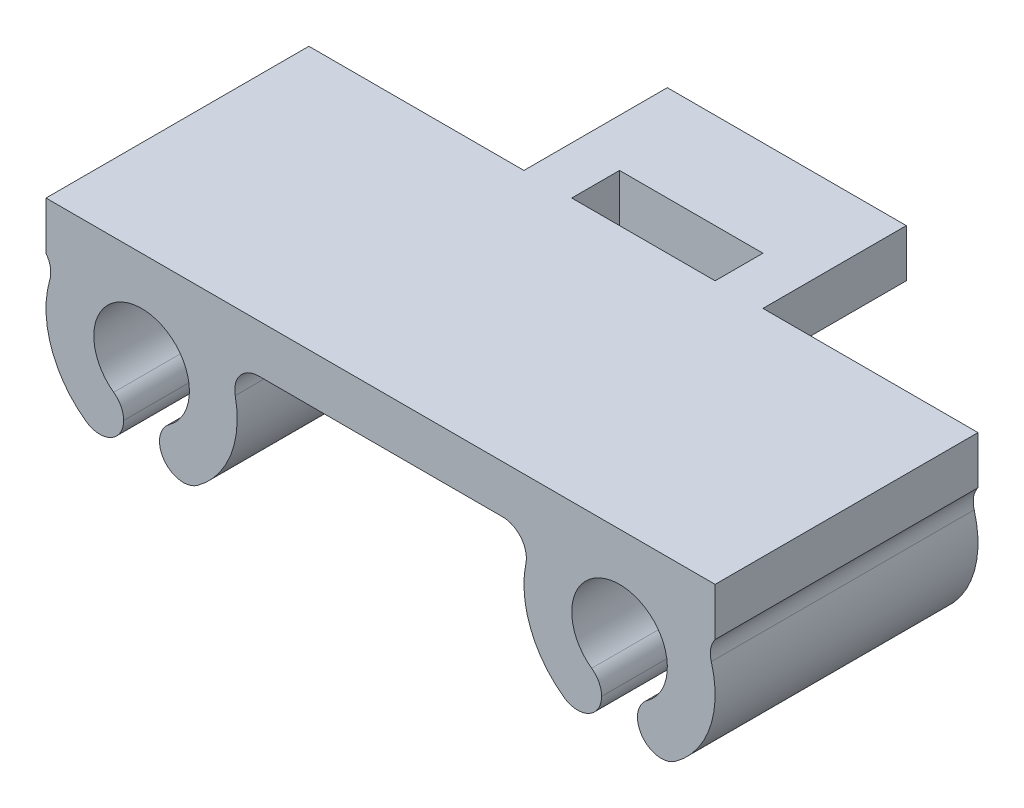
from build123d import *

# Parameters (mm, degrees)
SKETCH1_W           = 6
SKETCH1_H           = 2
BOSS_EXTRUDE1_DEPTH = 2
BOSS_EXTRUDE2_DEPTH = 5.5
FILLET1_R           = 1


with BuildPart() as part:
    # Sketch1 → Boss-Extrude1 (new body)
    with BuildSketch(Plane(origin=(0, 0, 0), x_dir=(1, 0, 0), z_dir=(0, 1, 0))):
        Polygon((-14, 5.5), (-14, -5.5), (14, -5.5), (14, 5.5), (5, 5.5), (5, 11.5), (-5, 11.5), (-5, 5.5), align=None)
        with Locations((0, 6.5)):
            Rectangle(SKETCH1_W, SKETCH1_H, mode=Mode.SUBTRACT)
    extrude(amount=BOSS_EXTRUDE1_DEPTH)

    # Sketch2 → Boss-Extrude2 (add, symmetric)
    with BuildSketch(Plane.XY):
        with BuildLine():
            Line((-10.75, -5.929058411), (-10.75, -3.854049622))
            ThreePointArc((-10.75, -3.854049622), (-10, 0), (-9.25, -3.854049622))
            Line((-9.25, -3.854049622), (-9.25, -5.929058411))
            ThreePointArc((-9.25, -5.929058411), (-10, 2), (-10.75, -5.929058411))
        make_face()
        with BuildLine():
            Line((9.25, -5.929058411), (9.25, -3.854049622))
            ThreePointArc((9.25, -3.854049622), (10, 0), (10.75, -3.854049622))
            Line((10.75, -3.854049622), (10.75, -5.929058411))
            ThreePointArc((10.75, -5.929058411), (10, 2), (9.25, -5.929058411))
        make_face()
    extrude(amount=BOSS_EXTRUDE2_DEPTH, both=True)

    # Fillet1
    # the kernel refuses this fillet: 1 mm, written as the material it adds along each edge
    with BuildSketch(Plane(origin=(-6.535898385, 0, -5.5), x_dir=(0.3545926272330996, -0.9350208921259076, 0), z_dir=(0, 0, 1))) as fillet1_piece_1:
        with BuildLine():
            CenterArc((1.443818006, 0.987048159), FILLET1_R, 159.231520484, 101.536959033)
            Line((0.508797114, 1.341640786), (0, 0))
            ThreePointArc((0, 0), (0.641696892, 0.051807363), (1.283393783, 0))
        make_face()
    extrude(amount=11)
    with BuildSketch(Plane(origin=(-13.464101615, 0, -5.5), x_dir=(-1, 0, 0), z_dir=(0, 0, 1))) as fillet1_piece_2:
        with BuildLine():
            CenterArc((1.335898385, 0.6), FILLET1_R, 163.739795292, 53.130102354)
            ThreePointArc((0.375898385, 0.88), (0.214359354, 0.428718708), (0, 0))
            Line((0, 0), (0.535898385, 0))
        make_face()
    extrude(amount=11)
    with BuildSketch(Plane(origin=(13.464101615, 0, -5.5), x_dir=(1, 0, 0), z_dir=(0, 0, 1))) as fillet1_piece_3:
        with BuildLine():
            CenterArc((1.335898385, -0.6), FILLET1_R, 143.130102354, 53.130102354)
            ThreePointArc((0.375898385, -0.88), (0.214359354, -0.428718708), (0, 0))
            Line((0, 0), (0.535898385, 0))
        make_face()
    extrude(amount=11)
    with BuildSketch(Plane(origin=(6.535898385, 0, -5.5), x_dir=(-0.3545926272330986, -0.935020892125908, 0), z_dir=(0, 0, 1))) as fillet1_piece_4:
        with BuildLine():
            CenterArc((1.443818006, -0.987048159), FILLET1_R, 99.231520484, 101.536959033)
            Line((0.508797114, -1.341640786), (0, 0))
            ThreePointArc((0, 0), (0.641696892, -0.051807363), (1.283393783, 0))
        make_face()
    extrude(amount=11)
    # the kernel refuses this fillet: 1 mm, written as the material it takes off along each edge
    with BuildSketch(Plane(origin=(10.75, -5.929058411, 9.808071734), x_dir=(0, 1, 0), z_dir=(0, 0, -1))) as fillet1_2_piece_1:
        with BuildLine():
            CenterArc((1.492359825, 1), FILLET1_R, 144.314665287, 125.685334713)
            ThreePointArc((0.680126963, 1.583333333), (0.253786895, 0.828727108), (0, 0))
            Line((0, 0), (1.492359825, 0))
        make_face()
    extrude(amount=19.616143468, mode=Mode.SUBTRACT)
    with BuildSketch(Plane(origin=(10.75, -3.854049622, -6.956622411), x_dir=(0.8758453103585752, 0.48259195219449225, 0), z_dir=(0, 0, 1))) as fillet1_2_piece_2:
        with BuildLine():
            CenterArc((0.594663609, -0.992902315), FILLET1_R, 96.830510938, 54.314665287)
            Line((-0.281181701, -0.510310363), (0, 0))
            ThreePointArc((0, 0), (0.237865444, -0.014195369), (0.475730887, 0))
        make_face()
    extrude(amount=13.913244822, mode=Mode.SUBTRACT)
    with BuildSketch(Plane(origin=(9.25, -5.929058411, 9.808071734), x_dir=(-0.9188178790368026, 0.39468177708416147, 0), z_dir=(0, 0, -1))) as fillet1_2_piece_3:
        with BuildLine():
            CenterArc((1.507825107, 0.976525112), FILLET1_R, 156.753871206, 125.685334713)
            Line((0.589007228, 1.371206889), (0, 0))
            ThreePointArc((0, 0), (0.861614347, -0.093899551), (1.723228694, 0))
        make_face()
    extrude(amount=19.616143468, mode=Mode.SUBTRACT)
    with BuildSketch(Plane(origin=(9.25, -3.854049622, -6.956622411), x_dir=(0, -1, 0), z_dir=(0, 0, 1))) as fillet1_2_piece_4:
        with BuildLine():
            CenterArc((0.582648964, -1), FILLET1_R, 90, 54.314665287)
            ThreePointArc((-0.229583898, -0.416666667), (-0.102359001, -0.215183904), (0, 0))
            Line((0, 0), (0.582648964, 0))
        make_face()
    extrude(amount=13.913244822, mode=Mode.SUBTRACT)
    with BuildSketch(Plane(origin=(-9.25, -3.854049622, -6.956622411), x_dir=(0, -1, 0), z_dir=(0, 0, 1))) as fillet1_2_piece_5:
        with BuildLine():
            CenterArc((0.582648964, 1), FILLET1_R, 215.685334713, 54.314665287)
            ThreePointArc((-0.229583898, 0.416666667), (-0.102359001, 0.215183904), (0, 0))
            Line((0, 0), (0.582648964, 0))
        make_face()
    extrude(amount=13.913244822, mode=Mode.SUBTRACT)
    with BuildSketch(Plane(origin=(-10.75, -3.854049622, -6.956622411), x_dir=(-0.8758453103585743, 0.4825919521944938, 0), z_dir=(0, 0, 1))) as fillet1_2_piece_6:
        with BuildLine():
            CenterArc((0.594663609, 0.992902315), FILLET1_R, 208.854823775, 54.314665287)
            Line((-0.281181701, 0.510310363), (0, 0))
            ThreePointArc((0, 0), (0.237865444, 0.014195369), (0.475730887, 0))
        make_face()
    extrude(amount=13.913244822, mode=Mode.SUBTRACT)
    with BuildSketch(Plane(origin=(-9.25, -5.929058411, 9.808071734), x_dir=(0.9188178790368028, 0.3946817770841608, 0), z_dir=(0, 0, -1))) as fillet1_2_piece_7:
        with BuildLine():
            CenterArc((1.507825107, -0.976525112), FILLET1_R, 77.560794081, 125.685334713)
            Line((0.589007228, -1.371206889), (0, 0))
            ThreePointArc((0, 0), (0.861614347, 0.093899551), (1.723228694, 0))
        make_face()
    extrude(amount=19.616143468, mode=Mode.SUBTRACT)
    with BuildSketch(Plane(origin=(-10.75, -5.929058411, 9.808071734), x_dir=(0, 1, 0), z_dir=(0, 0, -1))) as fillet1_2_piece_8:
        with BuildLine():
            CenterArc((1.492359825, -1), FILLET1_R, 90, 125.685334713)
            ThreePointArc((0.680126963, -1.583333333), (0.253786895, -0.828727108), (0, 0))
            Line((0, 0), (1.492359825, 0))
        make_face()
    extrude(amount=19.616143468, mode=Mode.SUBTRACT)


solid = part.part
